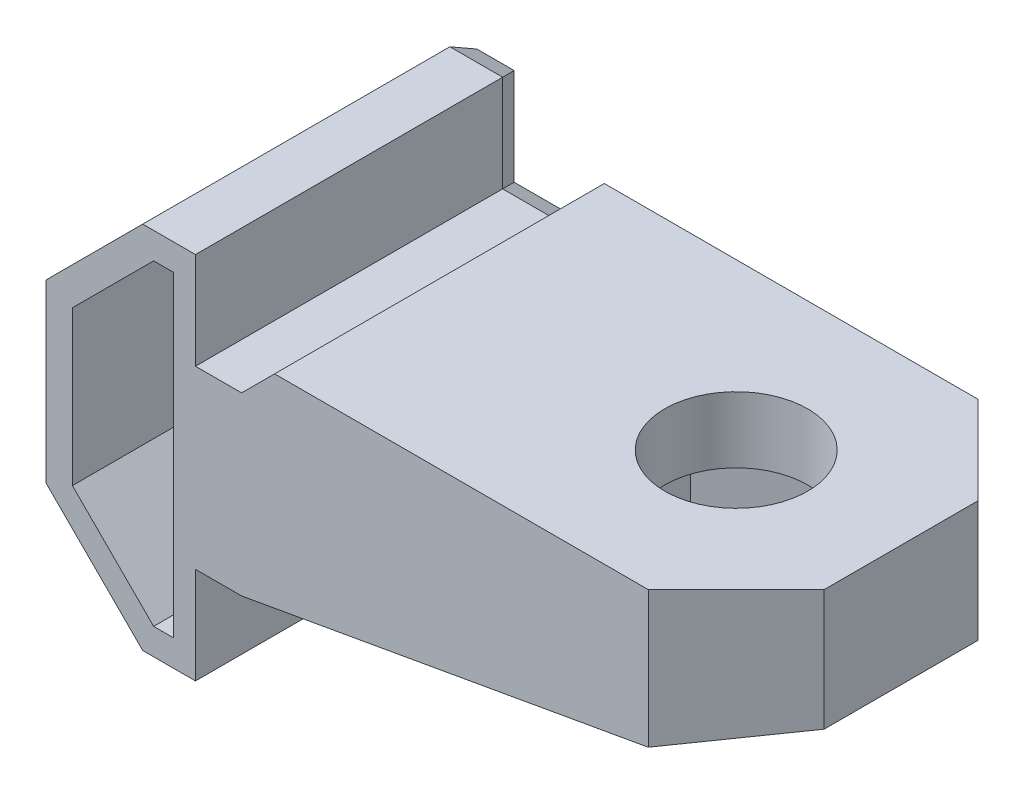
from build123d import *

# Parameters (mm, degrees)
SALIENTE_EXTRUIR1_DEPTH = 7.5
SALIENTE_EXTRUIR2_DEPTH = 15
CROQUIS7_R              = 3.25
CORTAR_EXTRUIR4_DEPTH   = 28.490180065
CORTAR_EXTRUIR5_START   = -3
CORTAR_EXTRUIR5_DEPTH   = 10
CROQUIS9_W              = 2.302374724
CROQUIS9_H              = 5.658032638
SALIENTE_EXTRUIR3_DEPTH = 7
CHAFL_N3_SIZE           = 2
CORTAR_EXTRUIR3_DEPTH   = 29.316249752
CHAFL_N4_SIZE           = 4
CHAFL_N2_SIZE           = 0.5
CHAFL_N2_SIZE2          = 1.025151921


with BuildPart() as part:
    # Croquis1 → Saliente-Extruir1 (new, symmetric)
    with BuildSketch(Plane.XY):
        Polygon((0, 4), (-2.1, 4), (-2.1, 8.4), (-4.5, 8.4), (-8.9, 4), (-8.9, -4), (-4.5, -8.4), (-2.1, -8.4), (-2.1, -4), (0, -4), align=None)
    extrude(amount=SALIENTE_EXTRUIR1_DEPTH, both=True)

    # Croquis6 → Saliente-Extruir2 (add, through all)
    with BuildSketch(Plane(origin=(0, 0, -7.5), x_dir=(-1, 0, 0), z_dir=(0, 0, -1))):
        Polygon((0, 4), (-1.5, 5.5), (-22.5, 5.5), (-22.5, 0), (0, -4), align=None)
    extrude(amount=-SALIENTE_EXTRUIR2_DEPTH)

    # Croquis7 → Cortar-Extruir4 (cut, through all)
    with BuildSketch(Plane(origin=(0, 5.5, 0), x_dir=(1, 0, 0), z_dir=(0, 1, 0))):
        with Locations(Location((15, 0, 0), (0, 0, 180))):
            Circle(CROQUIS7_R)
    extrude(amount=-CORTAR_EXTRUIR4_DEPTH, mode=Mode.SUBTRACT)

    # Croquis8 → Cortar-Extruir5 (cut)
    with BuildSketch(Plane(origin=(0, 5.5, 0), x_dir=(1, 0, 0), z_dir=(0, 1, 0)).offset(CORTAR_EXTRUIR5_START)):
        Polygon((15, 5.658032638), (10.1, 2.829016319), (10.1, -2.829016319), (15, -5.658032638), (19.9, -2.829016319), (19.9, 2.829016319), align=None)
    extrude(amount=-CORTAR_EXTRUIR5_DEPTH, mode=Mode.SUBTRACT)

    # Croquis9 → Saliente-Extruir3 (add)
    with BuildSketch(Plane.XZ.offset(-2.5)):
        with Locations((8.948812638, 0)):
            Rectangle(CROQUIS9_W, CROQUIS9_H)
    extrude(amount=SALIENTE_EXTRUIR3_DEPTH)

    # Chaflán3
    # the kernel refuses this chamfer: 2 mm, written as the material it adds along each edge
    with BuildSketch(Plane(origin=(2.733659972, -3.514016005, 2.829016319), x_dir=(-0.004812694974131689, 0.02707140922949076, 0.9996219169112968), z_dir=(0.9845625077859067, 0.1750333347174944, 0))) as chafl_n3_piece_1_section:
        Polygon((CHAFL_N3_SIZE * 0.999621916911, CHAFL_N3_SIZE * 0.0274958766106), (-CHAFL_N3_SIZE * 0.0274958766106, CHAFL_N3_SIZE * 0.999621916911), (0, 0), align=None)
    chafl_n3_piece_1 = extrude(amount=12.625206864, mode=Mode.PRIVATE)
    chafl_n3_piece_1 = split(chafl_n3_piece_1, bisect_by=Plane(origin=(9.52379564, -3.075112264, 2.496344577), z_dir=(-0.4999999999999998, 0, 0.8660254037844388)), keep=Keep.TOP, mode=Mode.PRIVATE)
    chafl_n3_piece_1 = split(chafl_n3_piece_1, bisect_by=Plane(origin=(7.797625276, -3.075112264, 3.490856258), z_dir=(1, 0, 0)), keep=Keep.TOP, mode=Mode.PRIVATE)
    chafl_n3_piece_1 = split(chafl_n3_piece_1, bisect_by=Plane(origin=(8.949614054, -4.5, 3.490856258), z_dir=(0, 1, 0)), keep=Keep.TOP, mode=Mode.PRIVATE)
    chafl_n3_piece_1 = split(chafl_n3_piece_1, bisect_by=Plane(origin=(10.1, -3.075112264, 3.490856258), z_dir=(-1, 0, 0)), keep=Keep.TOP, mode=Mode.PRIVATE)
    add(chafl_n3_piece_1)
    with BuildSketch(Plane(origin=(2.733659972, -3.514016005, 2.829016319), x_dir=(-0.004812694974131689, 0.02707140922949076, 0.9996219169112968), z_dir=(0.9845625077859067, 0.1750333347174944, 0))) as chafl_n3_piece_2_section:
        Polygon((CHAFL_N3_SIZE * 0.999621916911, CHAFL_N3_SIZE * 0.0274958766106), (-CHAFL_N3_SIZE * 0.0274958766106, CHAFL_N3_SIZE * 0.999621916911), (0, 0), align=None)
    chafl_n3_piece_2 = extrude(amount=12.625206864, mode=Mode.PRIVATE)
    chafl_n3_piece_2 = split(chafl_n3_piece_2, bisect_by=Plane(origin=(11.228614623, -2.50665574, 3.480622276), z_dir=(-0.4999999999999998, 0, 0.8660254037844388)), keep=Keep.TOP, mode=Mode.PRIVATE)
    chafl_n3_piece_2 = split(chafl_n3_piece_2, bisect_by=Plane(origin=(10.1, -2.50665574, 3.87158585), z_dir=(1, 0, 0)), keep=Keep.TOP, mode=Mode.PRIVATE)
    add(chafl_n3_piece_2)
    with BuildSketch(Plane(origin=(15.163965304, -1.304183946, -2.829016319), x_dir=(-0.004812694974131689, 0.02707140922949076, -0.9996219169112968), z_dir=(-0.9845625077859067, -0.1750333347174944, 0))) as chafl_n3_piece_3_section:
        Polygon((CHAFL_N3_SIZE * 0.999621916911, CHAFL_N3_SIZE * 0.0274958766106), (-CHAFL_N3_SIZE * 0.0274958766106, CHAFL_N3_SIZE * 0.999621916911), (0, 0), align=None)
    chafl_n3_piece_3 = extrude(amount=12.625206864, mode=Mode.PRIVATE)
    chafl_n3_piece_3 = split(chafl_n3_piece_3, bisect_by=Plane(origin=(11.228614623, -2.50665574, -3.480622276), z_dir=(-0.49999999999999994, 0, -0.8660254037844387)), keep=Keep.TOP, mode=Mode.PRIVATE)
    chafl_n3_piece_3 = split(chafl_n3_piece_3, bisect_by=Plane(origin=(10.1, -2.50665574, -3.87158585), z_dir=(1, 0, 0)), keep=Keep.TOP, mode=Mode.PRIVATE)
    add(chafl_n3_piece_3)
    with BuildSketch(Plane(origin=(15.163965304, -1.304183946, -2.829016319), x_dir=(-0.004812694974131689, 0.02707140922949076, -0.9996219169112968), z_dir=(-0.9845625077859067, -0.1750333347174944, 0))) as chafl_n3_piece_4_section:
        Polygon((CHAFL_N3_SIZE * 0.999621916911, CHAFL_N3_SIZE * 0.0274958766106), (-CHAFL_N3_SIZE * 0.0274958766106, CHAFL_N3_SIZE * 0.999621916911), (0, 0), align=None)
    chafl_n3_piece_4 = extrude(amount=12.625206864, mode=Mode.PRIVATE)
    chafl_n3_piece_4 = split(chafl_n3_piece_4, bisect_by=Plane(origin=(9.52379564, -3.075112264, -2.496344577), z_dir=(-0.49999999999999994, 0, -0.8660254037844387)), keep=Keep.TOP, mode=Mode.PRIVATE)
    chafl_n3_piece_4 = split(chafl_n3_piece_4, bisect_by=Plane(origin=(7.797625276, -3.075112264, -3.490856258), z_dir=(1, 0, 0)), keep=Keep.TOP, mode=Mode.PRIVATE)
    chafl_n3_piece_4 = split(chafl_n3_piece_4, bisect_by=Plane(origin=(10.1, -3.075112264, -3.490856258), z_dir=(-1, 0, 0)), keep=Keep.TOP, mode=Mode.PRIVATE)
    chafl_n3_piece_4 = split(chafl_n3_piece_4, bisect_by=Plane(origin=(8.949614054, -4.5, -3.490856258), z_dir=(0, 1, 0)), keep=Keep.TOP, mode=Mode.PRIVATE)
    add(chafl_n3_piece_4)

    # Croquis5 → Cortar-Extruir3 (cut, through all)
    with BuildSketch(Plane.XY.offset(7.5)):
        Polygon((-3.1, 7.2), (-3.1, -7.2), (-4.002943725, -7.2), (-7.7, -3.502943725), (-7.7, 3.502943725), (-4.002943725, 7.2), align=None)
    extrude(amount=-CORTAR_EXTRUIR3_DEPTH, mode=Mode.SUBTRACT)

    # Chaflán4
    chafl_n4_edges = [part.edges().sort_by_distance(p)[0] for p in [
        (22.5, 2.75, 7.5),
        (22.5, 2.75, -7.5),
    ]]
    chamfer(chafl_n4_edges, length=CHAFL_N4_SIZE)

    # Chaflán2
    chafl_n2_edges = [part.edges().sort_by_distance(p)[0] for p in [
        (-1.05, -4, -7.5),
        (-2.1, -6.2, -7.5),
        (-3.3, -8.4, -7.5),
        (-6.7, -6.2, -7.5),
        (-8.9, 0, -7.5),
        (-6.7, 6.2, -7.5),
        (-3.3, 8.4, -7.5),
        (-2.1, 6.2, -7.5),
        (-1.05, 4, -7.5),
    ]]
    chafl_n2_side = [part.faces().sort_by_distance(p)[0] for p in [
        (5.002983823, 1.055154991, -7.5),
    ]]
    chamfer(chafl_n2_edges, length=CHAFL_N2_SIZE, length2=CHAFL_N2_SIZE2, reference=chafl_n2_side[0])


solid = part.part
